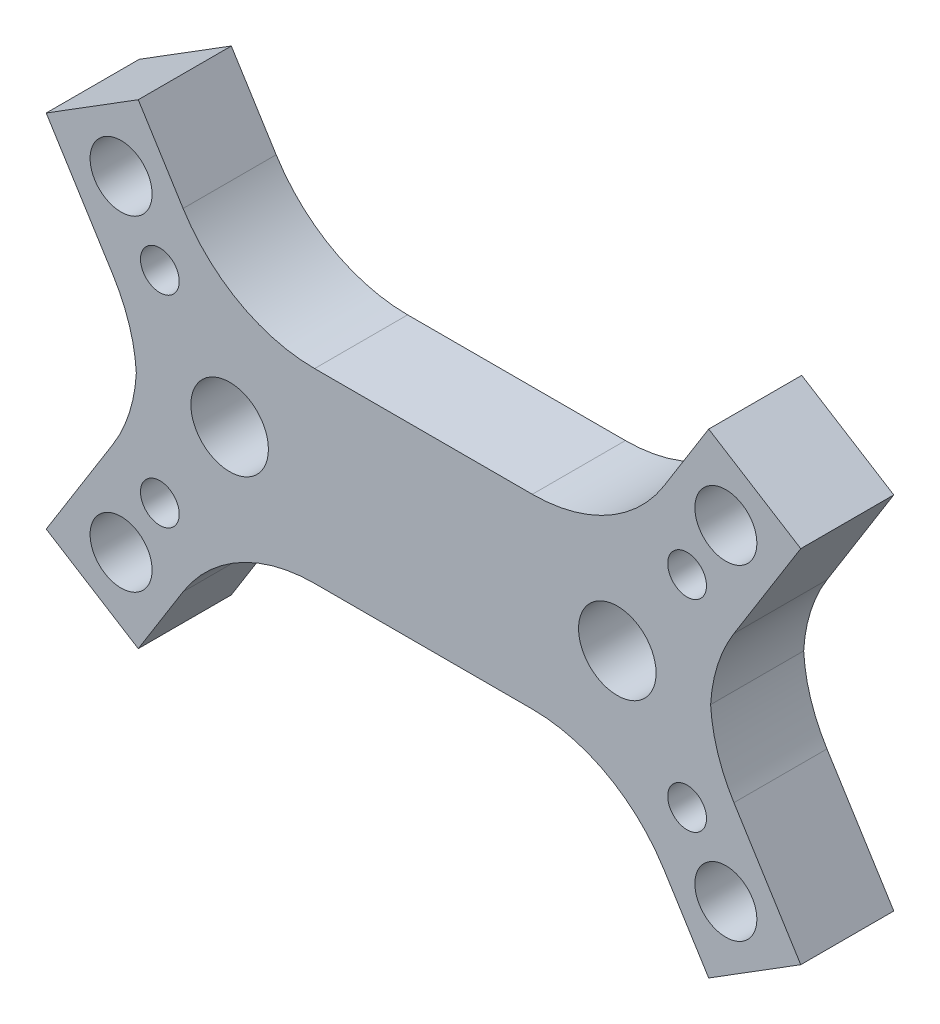
from build123d import *

# Parameters (mm, degrees)
BOSS_EXTRUDE1_DEPTH        = 1.2
HOLE1_D                    = 0.6
HOLE1_CBORE_D              = 1
HOLE1_CBORE_DEPTH          = 0.9
FILLET1_R                  = 2
F_0_8_0_8_DIAMETER_HOLE1_D = 0.8
F_0_5_0_5_DIAMETER_HOLE1_D = 0.5


with BuildPart() as part:
    # Sketch1 → Boss-Extrude1 (new body)
    with BuildSketch(Plane.XY.offset(1.2)):
        Polygon((0.021444953, -1.865705812), (1.187267335, 0), (6.212732665, 0), (7.378555047, -1.865705812), (8.565822381, -1.123818842), (7.4, 0.74188697), (7.4, 1.65811303), (8.565822381, 3.523818842), (7.378555047, 4.265705812), (6.212732665, 2.4), (1.187267335, 2.4), (0.021444953, 4.265705812), (-1.165822381, 3.523818842), (0, 1.65811303), (0, 0.74188697), (-1.165822381, -1.123818842), align=None)
    extrude(amount=-BOSS_EXTRUDE1_DEPTH)

    # Hole1 (through all)
    with Locations(Plane.XY.offset(1.2)):
        with Locations((1.2, 1.2), (6.2, 1.2)):
            CounterBoreHole(HOLE1_D / 2, HOLE1_CBORE_D / 2, HOLE1_CBORE_DEPTH)

    # Fillet1
    # the kernel refuses this fillet: 2 mm, written as the material it adds along each edge
    with BuildSketch(Plane(origin=(6.212732665, 2.4, 1.2), x_dir=(-1, 0, 0), z_dir=(0, 0, -1)), Plane(origin=(1.187267335, 2.4, 1.2), x_dir=(-0.5299192642332093, 0.8480480961564231, 0), z_dir=(0, 0, -1))) as fillet1_piece_1:
        with BuildLine():
            CenterArc((FILLET1_R * 0.554309051453, FILLET1_R), FILLET1_R, 212, 58)
            Line((-FILLET1_R * 0.293739044704, FILLET1_R * 0.470080735767), (0, 0))
            Line((0, 0), (FILLET1_R * 0.554309051453, 0))
        make_face()
    extrude(amount=1.2)
    with BuildSketch(Plane(origin=(7.4, 1.65811303, 1.2), x_dir=(0, -1, 0), z_dir=(0, 0, -1)), Plane(origin=(7.4, 0.74188697, 1.2), x_dir=(0.5299192642332092, -0.8480480961564232, 0), z_dir=(0, 0, -1))) as fillet1_piece_2:
        with BuildLine():
            CenterArc((FILLET1_R * 0.286745385759, -FILLET1_R), FILLET1_R, 90, 32)
            Line((-FILLET1_R * 0.243173878474, -FILLET1_R * 0.151951903844), (0, 0))
            Line((0, 0), (FILLET1_R * 0.286745385759, 0))
        make_face()
    extrude(amount=1.2)
    with BuildSketch(Plane(origin=(6.212732665, 0, 1.2), x_dir=(-1, 0, 0), z_dir=(0, 0, -1)), Plane(origin=(1.187267335, 0, 1.2), x_dir=(-0.5299192642332091, -0.8480480961564235, 0), z_dir=(0, 0, -1))) as fillet1_piece_3:
        with BuildLine():
            CenterArc((FILLET1_R * 0.554309051453, -FILLET1_R), FILLET1_R, 90, 58)
            Line((-FILLET1_R * 0.293739044704, -FILLET1_R * 0.470080735767), (0, 0))
            Line((0, 0), (FILLET1_R * 0.554309051453, 0))
        make_face()
    extrude(amount=1.2)
    with BuildSketch(Plane(origin=(0, 0.74188697, 1.2), x_dir=(-0.5299192642332088, -0.8480480961564235, 0), z_dir=(0, 0, -1)), Plane(origin=(0, 1.65811303, 1.2), x_dir=(0, -1, 0), z_dir=(0, 0, -1))) as fillet1_piece_4:
        with BuildLine():
            CenterArc((FILLET1_R * 0.286745385759, FILLET1_R), FILLET1_R, 238, 32)
            Line((-FILLET1_R * 0.243173878474, FILLET1_R * 0.151951903844), (0, 0))
            Line((0, 0), (FILLET1_R * 0.286745385759, 0))
        make_face()
    extrude(amount=1.2)

    # Ø0.8 (0.8) Diameter Hole1 (through all)
    with Locations(Plane.XY.offset(1.2)):
        with Locations((-0.2, 3.3), (7.6, 3.3), (-0.2, -0.9), (7.6, -0.9)):
            Hole(F_0_8_0_8_DIAMETER_HOLE1_D / 2)

    # Ø0.5 (0.5) Diameter Hole1 (through all)
    with Locations(Plane.XY.offset(1.2)):
        with Locations((7.1, -0.1), (0.3, -0.1), (0.3, 2.5), (7.1, 2.5)):
            Hole(F_0_5_0_5_DIAMETER_HOLE1_D / 2)


solid = part.part
